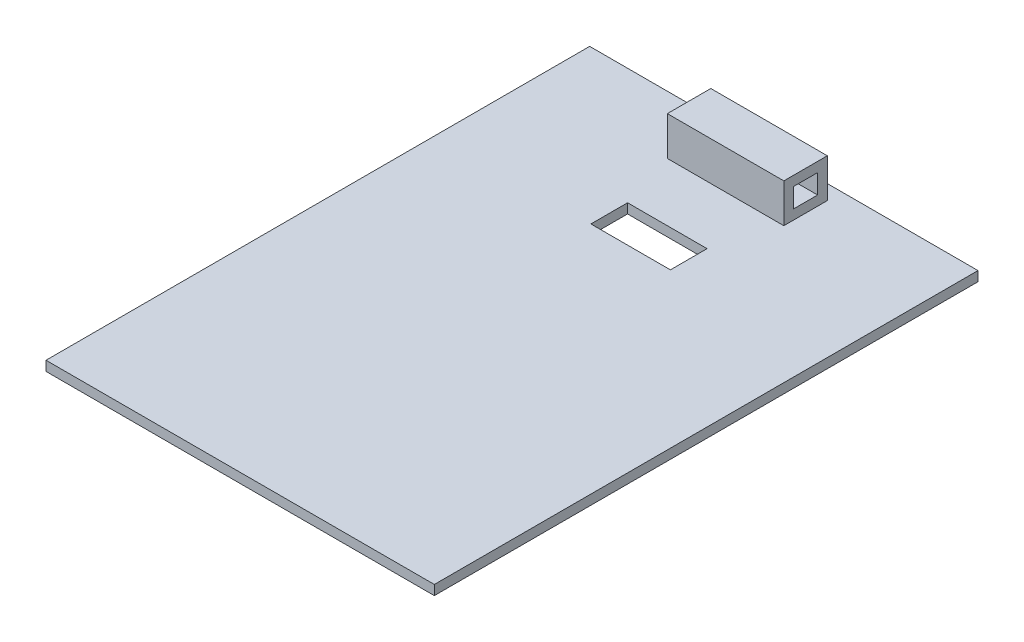
from build123d import *

# Parameters (mm, degrees)
SKETCH1_W           = 127
SKETCH1_H           = 177.8
SKETCH1_W_2         = 26
SKETCH1_H_2         = 12
BOSS_EXTRUDE2_DEPTH = 3.175
SKETCH5_W           = 38.1
SKETCH5_H           = 12.7
BOSS_EXTRUDE3_DEPTH = 14.224
CUT_EXTRUDE1_REACH  = 198.671
SKETCH8_W           = 7.874
SKETCH8_H           = 6.35


with BuildPart() as part:
    # Sketch1 → Boss-Extrude2 (new body)
    with BuildSketch(Plane(origin=(0, 0, 0), x_dir=(1, 0, 0), z_dir=(0, 1, 0))):
        with Locations((63.5, 88.9)):
            Rectangle(SKETCH1_W, SKETCH1_H)
        with Locations((63.5, 133.7)):
            Rectangle(SKETCH1_W_2, SKETCH1_H_2, mode=Mode.SUBTRACT)
    extrude(amount=BOSS_EXTRUDE2_DEPTH)

    # Sketch5 → Boss-Extrude3 (add)
    with BuildSketch(Plane(origin=(0, 0, -158.75), x_dir=(-1, 0, 0), z_dir=(0, 0, -1))):
        with Locations((-63.5, 9.525)):
            Rectangle(SKETCH5_W, SKETCH5_H)
    extrude(amount=BOSS_EXTRUDE3_DEPTH)

    # Sketch8 → Cut-Extrude1 (cut, up to next)
    with BuildSketch(Plane(origin=(82.55, 0, 0), x_dir=(0, 0, -1), z_dir=(1, 0, 0)), mode=Mode.PRIVATE) as cut_extrude1_sk1:
        with Locations((165.862, 9.525)):
            Rectangle(SKETCH8_W, SKETCH8_H)
    cut_extrude1_tool1 = extrude(cut_extrude1_sk1.sketch, amount=-CUT_EXTRUDE1_REACH, mode=Mode.PRIVATE) & part.part
    add(cut_extrude1_tool1.solids().sort_by_distance((82.55, 9.525, -165.862))[0], mode=Mode.SUBTRACT)


solid = part.part
